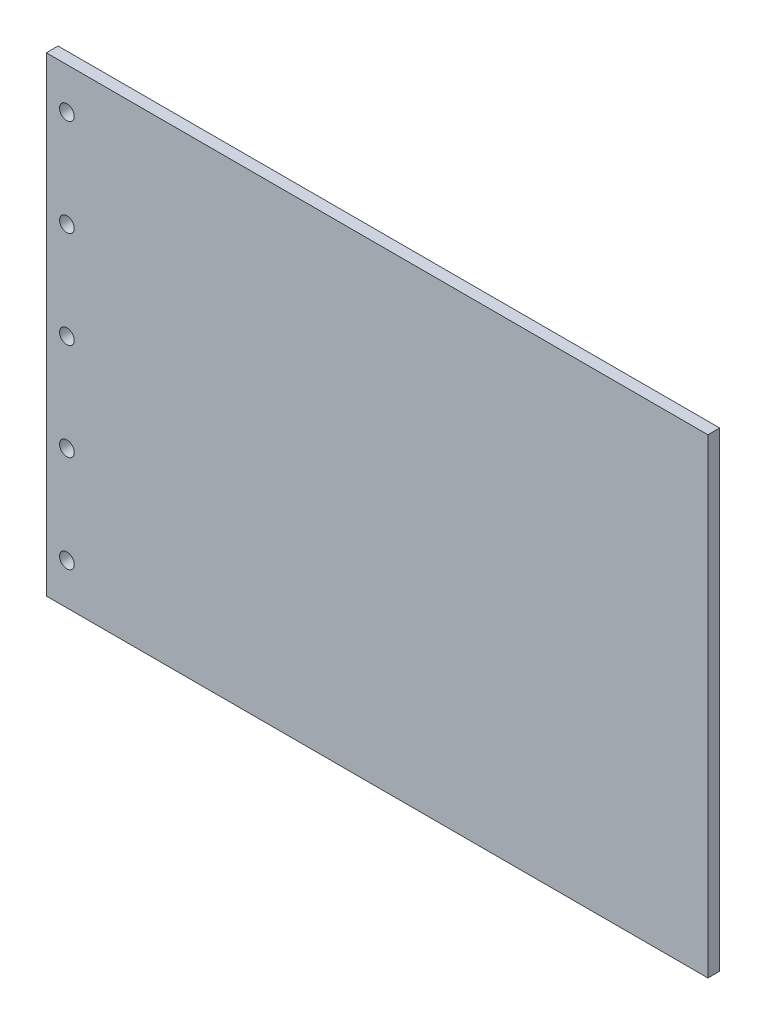
from build123d import *

# Parameters (mm, degrees)
SKETCH_1_W      = 225
SKETCH_1_H      = 160
SKETCH_1_R      = 2.5
EXTRUDE_1_DEPTH = 4


with BuildPart() as part:
    # Эскиз1 → Бобышка-Вытянуть1 (new body)
    with BuildSketch(Plane.XY):
        with Locations((112.5, 80)):
            Rectangle(SKETCH_1_W, SKETCH_1_H)
        with Locations((7, 80)):
            Circle(SKETCH_1_R, mode=Mode.SUBTRACT)
        with Locations((7, 47)):
            Circle(SKETCH_1_R, mode=Mode.SUBTRACT)
        with Locations((7, 14)):
            Circle(SKETCH_1_R, mode=Mode.SUBTRACT)
        with Locations((7, 113)):
            Circle(SKETCH_1_R, mode=Mode.SUBTRACT)
        with Locations((7, 146)):
            Circle(SKETCH_1_R, mode=Mode.SUBTRACT)
    extrude(amount=EXTRUDE_1_DEPTH)


solid = part.part
